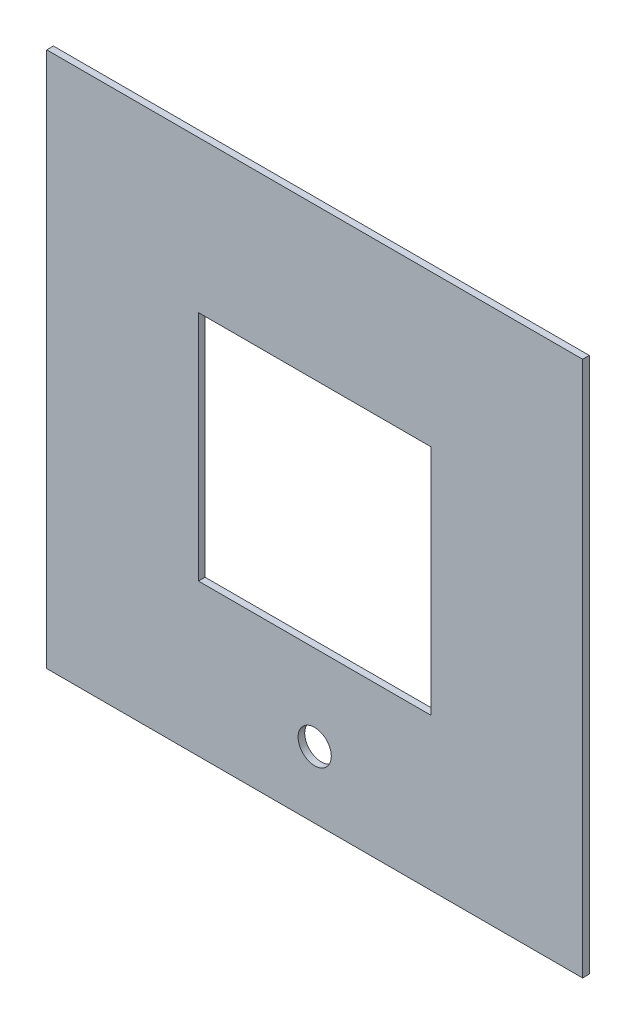
from build123d import *

# Parameters (mm, degrees)
SKETCH1_W           = 242
SKETCH1_H           = 242
SKETCH1_W_2         = 105
SKETCH1_H_2         = 105
BOSS_EXTRUDE1_DEPTH = 3
CUT_EXTRUDE1_REACH  = 173.146
SKETCH2_R           = 7.5


with BuildPart() as part:
    # Sketch1 → Boss-Extrude1 (new body)
    with BuildSketch(Plane.XY):
        Rectangle(SKETCH1_W, SKETCH1_H)
        Rectangle(SKETCH1_W_2, SKETCH1_H_2, mode=Mode.SUBTRACT)
    extrude(amount=BOSS_EXTRUDE1_DEPTH)

    # Sketch2 → Cut-Extrude1 (cut, up to next)
    with BuildSketch(Plane.XY.offset(3), mode=Mode.PRIVATE) as cut_extrude1_sk1:
        with Locations((0, -91)):
            Circle(SKETCH2_R)
    cut_extrude1_tool1 = extrude(cut_extrude1_sk1.sketch, amount=-CUT_EXTRUDE1_REACH, mode=Mode.PRIVATE) & part.part
    add(cut_extrude1_tool1.solids().sort_by_distance((0, -91, 3))[0], mode=Mode.SUBTRACT)


solid = part.part
